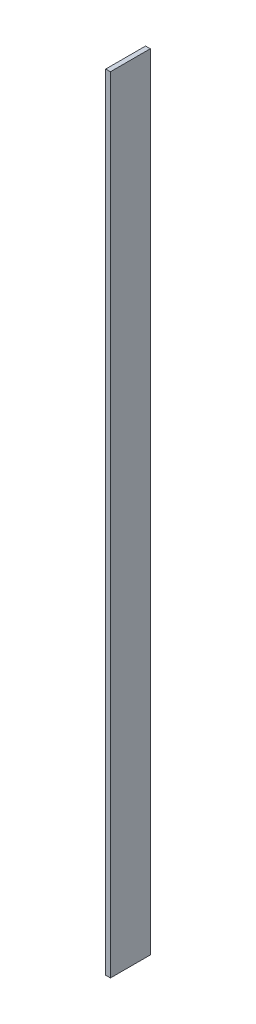
from build123d import *

# Parameters (mm, degrees)
ESBO_O1_W          = 3
ESBO_O1_H          = 500
FLANGE_BASE1_DEPTH = 25.4


# Sheet-metal steps are written as plain solids
with BuildPart() as part:
    # Esboço1 → Flange-base1 (new body)
    with BuildSketch(Plane.XY):
        with Locations((1.5, 250)):
            Rectangle(ESBO_O1_W, ESBO_O1_H)
    extrude(amount=FLANGE_BASE1_DEPTH)


solid = part.part
